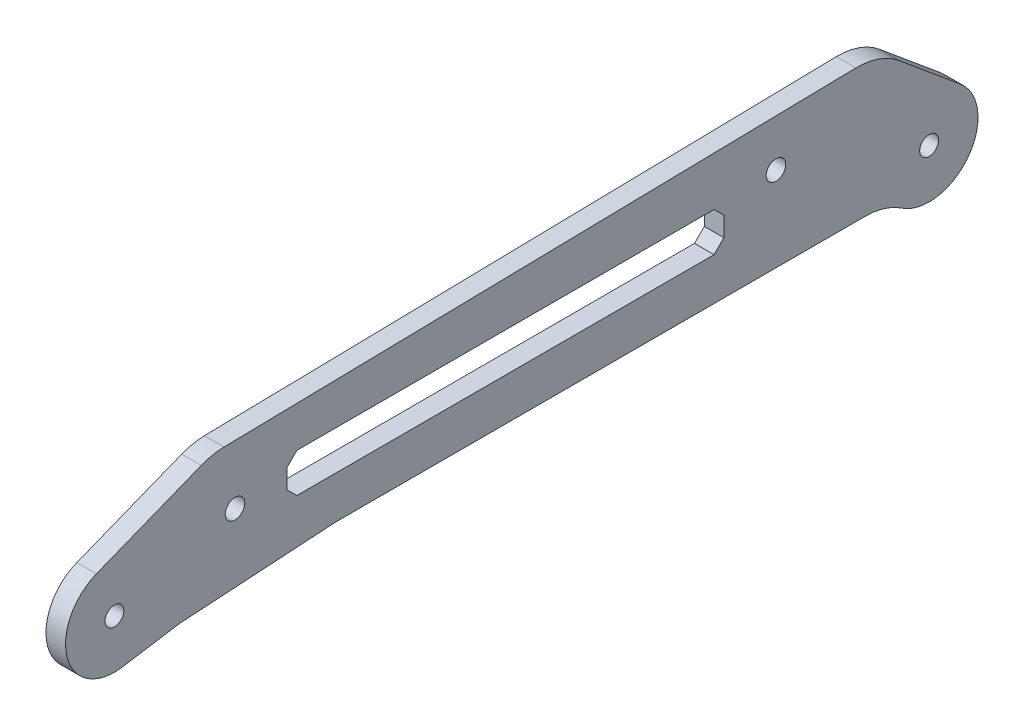
from build123d import *

# Parameters (mm, degrees)
SKETCH1_R           = 1.45
SKETCH1_R_2         = 1.5
BOSS_EXTRUDE1_DEPTH = 1.5
FILLET1_R           = 10


with BuildPart() as part:
    # Sketch1 → Boss-Extrude1 (new, symmetric)
    with BuildSketch(Plane(origin=(0, 0, 0), x_dir=(0, 0, -1), z_dir=(1, 0, 0))):
        with BuildLine():
            Line((-110, 14), (-127.759109434, 6.974045822))
            ThreePointArc((-127.759109434, 6.974045822), (-132.233383985, -1.981957648), (-123.818844483, -7.406407472))
            Line((-123.818844483, -7.406407472), (-115, -6))
            Line((-115, -6), (-91, -4.5))
            Line((-91, -4.5), (-6, -4.5))
            ThreePointArc((-6, -4.5), (5.167384395, -5.435819948), (4.797838271, 5.764611689))
            Line((4.797838271, 5.764611689), (-7.5, 16))
            Line((-7.5, 16), (-110, 14))
        make_face()
        with Locations((-125, 0)):
            Circle(SKETCH1_R, mode=Mode.SUBTRACT)
        with Locations((-106.5, 5)):
            Circle(SKETCH1_R_2, mode=Mode.SUBTRACT)
        Polygon((-98.5, 3.5), (-98.5, 6.5), (-97, 8), (-33, 8), (-31.5, 6.5), (-31.5, 3.5), (-33, 2), (-97, 2), align=None, mode=Mode.SUBTRACT)
        with Locations((-23.5, 8.5)):
            Circle(SKETCH1_R_2, mode=Mode.SUBTRACT)
        Circle(SKETCH1_R, mode=Mode.SUBTRACT)
    extrude(amount=BOSS_EXTRUDE1_DEPTH, both=True)

    # Fillet1
    # the kernel refuses this fillet: 10 mm, written as the material it adds along each edge
    with BuildSketch(Plane(origin=(1.5, -4.5, 6), x_dir=(0, -0.6894794553430702, -0.7243052399781623), z_dir=(-1, 0, 0))) as fillet1_piece_1:
        with BuildLine():
            CenterArc((4.143912969, 9.861667083), FILLET1_R, 226.411082638, 34.04773237)
            Line((-2.750881584, 2.618614683), (0, 0))
            ThreePointArc((0, 0), (1.243173891, 0.103749688), (2.486347782, 0))
        make_face()
    extrude(amount=3)
    with BuildSketch(Plane(origin=(1.5, -4.5, 91), x_dir=(0, 0, -1), z_dir=(-1, 0, 0))) as fillet1_piece_2:
        with BuildLine():
            CenterArc((FILLET1_R * 0.0312195418814, FILLET1_R), FILLET1_R, 266.423665625, 3.576334375)
            Line((-FILLET1_R * 0.0311587442738, FILLET1_R * 0.00194742151711), (0, 0))
            Line((0, 0), (FILLET1_R * 0.0312195418814, 0))
        make_face()
    extrude(amount=3)
    with BuildSketch(Plane(origin=(-1.5, -6, 115), x_dir=(0, 0.06237828615518053, -0.9980525784828885), z_dir=(1, 0, 0))) as fillet1_piece_3:
        with BuildLine():
            CenterArc((FILLET1_R * 0.04790007143, -FILLET1_R), FILLET1_R, 90, 5.484751657)
            Line((-FILLET1_R * 0.0476807691396, -FILLET1_R * 0.00457832909063), (0, 0))
            Line((0, 0), (FILLET1_R * 0.04790007143, 0))
        make_face()
    extrude(amount=3)
    # the kernel refuses this fillet: 10 mm, written as the material it takes off along each edge
    with BuildSketch(Plane(origin=(-6.013343282, 14, 110), x_dir=(0, 0.019508481784595348, -0.99980969146056), z_dir=(1, 0, 0))) as fillet1_2_piece_1:
        with BuildLine():
            CenterArc((FILLET1_R * 0.180533731282, -FILLET1_R), FILLET1_R, 90, 20.467183595)
            Line((-FILLET1_R * 0.169137109533, -FILLET1_R * 0.063127381613), (0, 0))
            Line((0, 0), (FILLET1_R * 0.180533731282, 0))
        make_face()
    extrude(amount=12.026686564, mode=Mode.SUBTRACT)
    with BuildSketch(Plane(origin=(-10.819315302, 16, 7.5), x_dir=(0, -0.6397117694155324, -0.7686148919135308), z_dir=(1, 0, 0))) as fillet1_2_piece_2:
        with BuildLine():
            CenterArc((FILLET1_R * 0.372772612074, -FILLET1_R), FILLET1_R, 90, 40.88815481)
            Line((-FILLET1_R * 0.281811924347, -FILLET1_R * 0.244011187465), (0, 0))
            Line((0, 0), (FILLET1_R * 0.372772612074, 0))
        make_face()
    extrude(amount=21.638630604, mode=Mode.SUBTRACT)


solid = part.part
